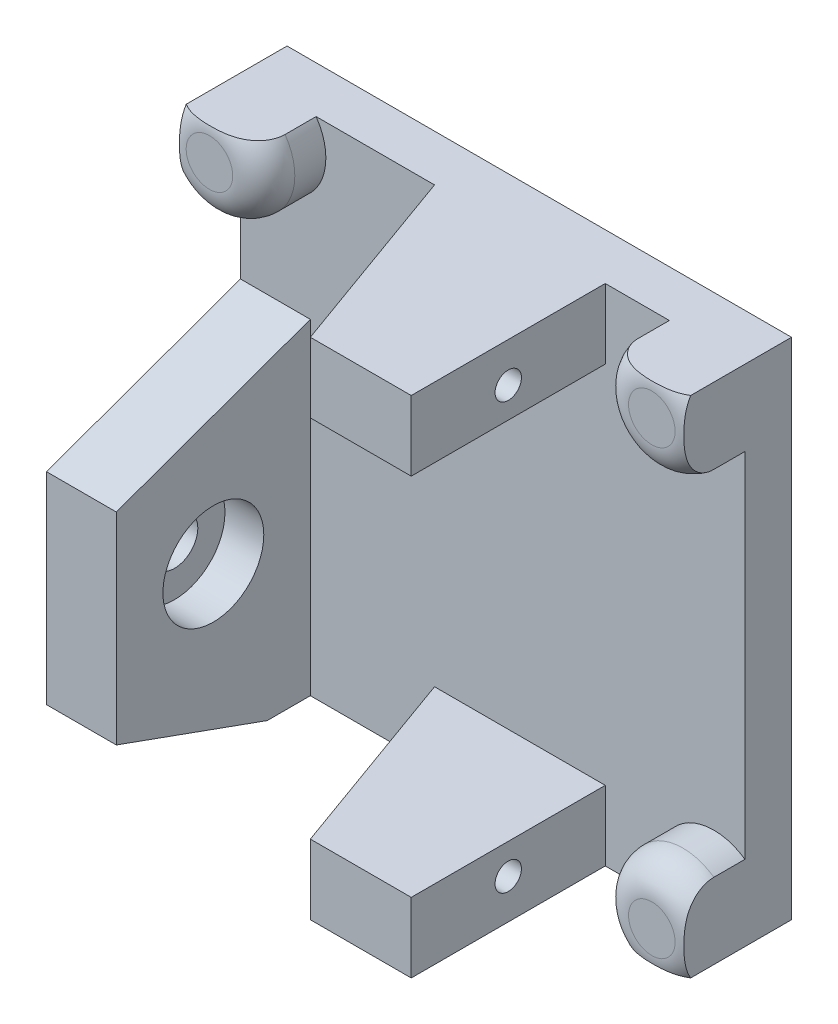
from build123d import *

# Parameters (mm, degrees)
EXTRUDE_635_DEPTH      = 6.25
SKETCH_691_R           = 0.85
CUT_EXTRUDE_915_DEPTH  = 5.5
SKETCH_5_W             = 2.5
SKETCH_5_H             = 8
CUT_EXTRUDE_1224_DEPTH = 4.5
SKETCH_1_W             = 32.5
SKETCH_1_H             = 32.5
EXTRUDE_1784_DEPTH     = 3
SKETCH_4_R             = 1.5
CUT_EXTRUDE_2137_DEPTH = 34.669348078
SKETCH_9_R             = 2.5
CUT_EXTRUDE_4617_DEPTH = 2.5
FILLET_3_R             = 2.5
SKETCH_10_W            = 12.5
SKETCH_10_H            = 12.5
CUT_EXTRUDE_5023_DEPTH = 39.52353177
CUT_EXTRUDE_5450_REACH = 39.495
SKETCH_13_W            = 12.5
SKETCH_13_H            = 16
SKETCH_13_H_2          = 3.5
CHAMFER_3_SIZE         = 4.5
CHAMFER_3_SIZE_2       = 12.5
CHAMFER_4_SIZE2        = 12.5
CHAMFER_4_SIZE         = 4.5
SKETCH_15_R            = 0.75
CUT_EXTRUDE_5895_DEPTH = 7
EXTRUDE_6483_DEPTH     = 4
SKETCH_17_R            = 3.25
CUT_EXTRUDE_7051_DEPTH = 2.5


with BuildPart() as part:
    # Эскиз2 → Extrude 635 (new, symmetric)
    with BuildSketch(Plane.XY):
        Polygon((9.5, 16.25), (-14, 16.25), (-14, -16.25), (9.5, -16.25), (9.5, -11.75), (-9.5, -11.75), (-9.5, 11.75), (9.5, 11.75), align=None)
    extrude(amount=EXTRUDE_635_DEPTH, both=True)

    # Sketch 691 → Cut-Extrude 915 (cut)
    with BuildSketch(Plane(origin=(9.5, 0, 0), x_dir=(0, 0, -1), z_dir=(1, 0, 0))):
        with Locations((0, 13.7)):
            Circle(SKETCH_691_R)
        with Locations((0, -13.7)):
            Circle(SKETCH_691_R)
    extrude(amount=-CUT_EXTRUDE_915_DEPTH, mode=Mode.SUBTRACT)

    # Эскиз5 → Cut-Extrude 1224 (cut)
    with BuildSketch(Plane.XZ.offset(11.75)):
        with Locations((-4.2, 2.25)):
            Rectangle(SKETCH_5_W, SKETCH_5_H)
    extrude(amount=CUT_EXTRUDE_1224_DEPTH, mode=Mode.SUBTRACT)

    # Эскиз1 → Extrude 1784 (add)
    with BuildSketch(Plane(origin=(0, 0, -6.25), x_dir=(-1, 0, 0), z_dir=(0, 0, -1))):
        with Locations((-2.25, 0)):
            Rectangle(SKETCH_1_W, SKETCH_1_H)
    extrude(amount=EXTRUDE_1784_DEPTH)

    # Эскиз4 → Cut-Extrude 2137 (cut, through all)
    with BuildSketch(Plane(origin=(-9.5, 0, 0), x_dir=(0, 0, -1), z_dir=(1, 0, 0))):
        with Locations(Location((0, -5.77, 0), (0, 0, 90))):
            Circle(SKETCH_4_R)
    extrude(amount=-CUT_EXTRUDE_2137_DEPTH, mode=Mode.SUBTRACT)

    # Эскиз9 → Cut-Extrude 4617 (cut)
    with BuildSketch(Plane(origin=(0, 0, -9.25), x_dir=(-1, 0, 0), z_dir=(0, 0, -1))):
        with Locations((-11.75, 0)):
            Circle(SKETCH_9_R)
        with Locations((7.25, 0)):
            Circle(SKETCH_9_R)
    extrude(amount=-CUT_EXTRUDE_4617_DEPTH, mode=Mode.SUBTRACT)

    # Скругление3
    fillet_3_edges = [part.edges().sort_by_distance(p)[0] for p in [
        (14.25, 0, -6.75),
        (-4.75, 0, -6.75),
    ]]
    fillet(fillet_3_edges, radius=FILLET_3_R - 0.0001)  # a hair under: the kernel refuses the full size

    # Эскиз10 → Cut-Extrude 5023 (cut, through all)
    with BuildSketch(Plane(origin=(0, 16.25, 0), x_dir=(1, 0, 0), z_dir=(0, 1, 0))):
        with Locations((-3.25, 0)):
            Rectangle(SKETCH_10_W, SKETCH_10_H)
    extrude(amount=-CUT_EXTRUDE_5023_DEPTH, mode=Mode.SUBTRACT)

    # Эскиз13 → Cut-Extrude 5450 (cut, up to next)
    with BuildSketch(Plane.ZY.offset(14), mode=Mode.PRIVATE) as cut_extrude_5450_sk1:
        with Locations((0, 8.25)):
            Rectangle(SKETCH_13_W, SKETCH_13_H)
    cut_extrude_5450_tool1 = extrude(cut_extrude_5450_sk1.sketch, amount=-CUT_EXTRUDE_5450_REACH, mode=Mode.PRIVATE) & part.part
    # Эскиз13 → Cut-Extrude 5450 (cut, up to next)
    with BuildSketch(Plane.ZY.offset(14), mode=Mode.PRIVATE) as cut_extrude_5450_sk2:
        with Locations((0, -14.5)):
            Rectangle(SKETCH_13_W, SKETCH_13_H_2)
    cut_extrude_5450_tool2 = extrude(cut_extrude_5450_sk2.sketch, amount=-CUT_EXTRUDE_5450_REACH, mode=Mode.PRIVATE) & part.part
    add(cut_extrude_5450_tool1.solids().sort_by_distance((-14, 8.25, 0))[0], mode=Mode.SUBTRACT)
    add(cut_extrude_5450_tool2.solids().sort_by_distance((-14, -14.5, 0))[0], mode=Mode.SUBTRACT)

    # Фаска3
    # the kernel refuses this chamfer: 12.5, 4.5 mm, written as the material it adds along each edge
    with BuildSketch(Plane(origin=(3, 16.25, -6.25), x_dir=(-1, 0, 0), z_dir=(0, -1, 0))) as chamfer_3_piece_1:
        Polygon((CHAMFER_3_SIZE, 0), (0, -CHAMFER_3_SIZE_2), (0, 0), align=None)
    extrude(amount=4.5)
    with BuildSketch(Plane(origin=(3, 48.678873385, -6.25), x_dir=(-1, 0, 0), z_dir=(0, -1, 0))) as chamfer_3_piece_2_section:
        Polygon((CHAMFER_3_SIZE, 0), (0, -CHAMFER_3_SIZE_2), (0, 0), align=None)
    chamfer_3_piece_2 = extrude(amount=69.357746771, mode=Mode.PRIVATE)
    chamfer_3_piece_2 = split(chamfer_3_piece_2, bisect_by=Plane(origin=(3, -16.25, -6.25), z_dir=(0, 1, 0)), keep=Keep.TOP, mode=Mode.PRIVATE)
    chamfer_3_piece_2 = split(chamfer_3_piece_2, bisect_by=Plane(origin=(3, -11.75, -6.25), z_dir=(0, -1, 0)), keep=Keep.TOP, mode=Mode.PRIVATE)
    add(chamfer_3_piece_2)
    with BuildSketch(Plane(origin=(3, 20.678873385, -6.25), x_dir=(0, 0, 1), z_dir=(0, -1, 0))) as chamfer_3_piece_3_section:
        Polygon((CHAMFER_3_SIZE_2, 0), (0, CHAMFER_3_SIZE), (0, 0), align=None)
    chamfer_3_piece_3 = extrude(amount=69.357746771, mode=Mode.PRIVATE)
    chamfer_3_piece_3 = split(chamfer_3_piece_3, bisect_by=Plane(origin=(3, 11.75, -6.25), z_dir=(0, 1, 0)), keep=Keep.TOP, mode=Mode.PRIVATE)
    chamfer_3_piece_3 = split(chamfer_3_piece_3, bisect_by=Plane(origin=(3, 16.25, -6.25), z_dir=(0, -1, 0)), keep=Keep.TOP, mode=Mode.PRIVATE)
    add(chamfer_3_piece_3)
    with BuildSketch(Plane(origin=(3, -11.75, -6.25), x_dir=(0, 0, 1), z_dir=(0, -1, 0))) as chamfer_3_piece_4:
        Polygon((CHAMFER_3_SIZE_2, 0), (0, CHAMFER_3_SIZE), (0, 0), align=None)
    extrude(amount=4.5)
    with BuildSketch(Plane(origin=(-14, -12.75, -6.25), x_dir=(0, -1, 0), z_dir=(1, 0, 0))) as chamfer_3_piece_5_section:
        Polygon((CHAMFER_3_SIZE, 0), (0, -CHAMFER_3_SIZE_2), (0, 0), align=None)
    chamfer_3_piece_5 = extrude(amount=4.5, mode=Mode.PRIVATE)
    chamfer_3_piece_5 = split(chamfer_3_piece_5, bisect_by=Plane(origin=(-14, -16.25, -6.25), z_dir=(0, 1, 0)), keep=Keep.TOP, mode=Mode.PRIVATE)
    add(chamfer_3_piece_5)

    # Фаска4
    chamfer_4_edges = [part.edges().sort_by_distance(p)[0] for p in [
        (-11.75, 0.25, -6.25),
    ]]
    chamfer_4_side = [part.faces().sort_by_distance(p)[0] for p in [
        (-11.75, 0.34, -6.25),
    ]]
    chamfer(chamfer_4_edges, length=CHAMFER_4_SIZE - 0.0001, length2=CHAMFER_4_SIZE2 - 0.0001, reference=chamfer_4_side[0])  # a hair under: the kernel refuses the full size

    # Эскиз15 → Cut-Extrude 5895 (cut)
    with BuildSketch(Plane(origin=(0, 0, -9.25), x_dir=(-1, 0, 0), z_dir=(0, 0, -1))):
        with Locations((12, -14.25)):
            Circle(SKETCH_15_R)
        with Locations((12, 14.25)):
            Circle(SKETCH_15_R)
        with Locations((-16.5, 14.25)):
            Circle(SKETCH_15_R)
        with Locations((-16.5, -14.25)):
            Circle(SKETCH_15_R)
    extrude(amount=-CUT_EXTRUDE_5895_DEPTH, mode=Mode.SUBTRACT)

    # Эскиз16 → Extrude 6483 (add)
    with BuildSketch(Plane.XY.offset(-6.25)):
        with BuildLine():
            Line((-14, 11.377718677), (-14, 16.25))
            Line((-14, 16.25), (-9.127718677, 16.25))
            ThreePointArc((-9.127718677, 16.25), (-9.525126266, 11.775126266), (-14, 11.377718677))
        make_face()
        with BuildLine():
            Line((13.627718677, 16.25), (18.5, 16.25))
            Line((18.5, 16.25), (18.5, 11.377718677))
            ThreePointArc((18.5, 11.377718677), (14.025126266, 11.775126266), (13.627718677, 16.25))
        make_face()
        with BuildLine():
            Line((18.5, -11.377718677), (18.5, -16.25))
            Line((18.5, -16.25), (13.627718677, -16.25))
            ThreePointArc((13.627718677, -16.25), (14.025126266, -11.775126266), (18.5, -11.377718677))
        make_face()
    extrude(amount=EXTRUDE_6483_DEPTH)

    # Скругление4: read off the stored shape, not the designer's step
    # Скругление4 outline → Скругление4 (revolve, cut)
    with BuildSketch(Plane(origin=(16.5, 14.25, 0), x_dir=(1, 0, 0), z_dir=(0, -1, 0))):
        with BuildLine():
            ThreePointArc((1.5, -2.25), (2.914213562, -2.835786438), (3.5, -4.25))
            Line((3.5, -4.25), (3.5, -2.25))
            Line((3.5, -2.25), (1.5, -2.25))
        make_face()
    revolve(axis=Axis((16.5, 14.25, 0), (0, 0, 1)), mode=Mode.SUBTRACT)

    # Fillet 4 2 outline → Fillet 4 2 (revolve, cut)
    with BuildSketch(Plane(origin=(-12, 14.25, 0), x_dir=(1, 0, 0), z_dir=(0, -1, 0))):
        with BuildLine():
            ThreePointArc((1.5, -2.25), (2.914213562, -2.835786438), (3.5, -4.25))
            Line((3.5, -4.25), (3.5, -2.25))
            Line((3.5, -2.25), (1.5, -2.25))
        make_face()
    revolve(axis=Axis((-12, 14.25, 0), (0, 0, 1)), mode=Mode.SUBTRACT)

    # Fillet 4 3 outline → Fillet 4 3 (revolve, cut)
    with BuildSketch(Plane(origin=(16.5, -14.25, 0), x_dir=(1, 0, 0), z_dir=(0, -1, 0))):
        with BuildLine():
            ThreePointArc((1.5, -2.25), (2.914213562, -2.835786438), (3.5, -4.25))
            Line((3.5, -4.25), (3.5, -2.25))
            Line((3.5, -2.25), (1.5, -2.25))
        make_face()
    revolve(axis=Axis((16.5, -14.25, 0), (0, 0, 1)), mode=Mode.SUBTRACT)

    # Эскиз17 → Cut-Extrude 7051 (cut)
    with BuildSketch(Plane(origin=(-9.5, 0, 0), x_dir=(0, 0, -1), z_dir=(1, 0, 0))):
        with Locations((0, -5.77)):
            Circle(SKETCH_17_R)
    extrude(amount=-CUT_EXTRUDE_7051_DEPTH, mode=Mode.SUBTRACT)


solid = part.part
